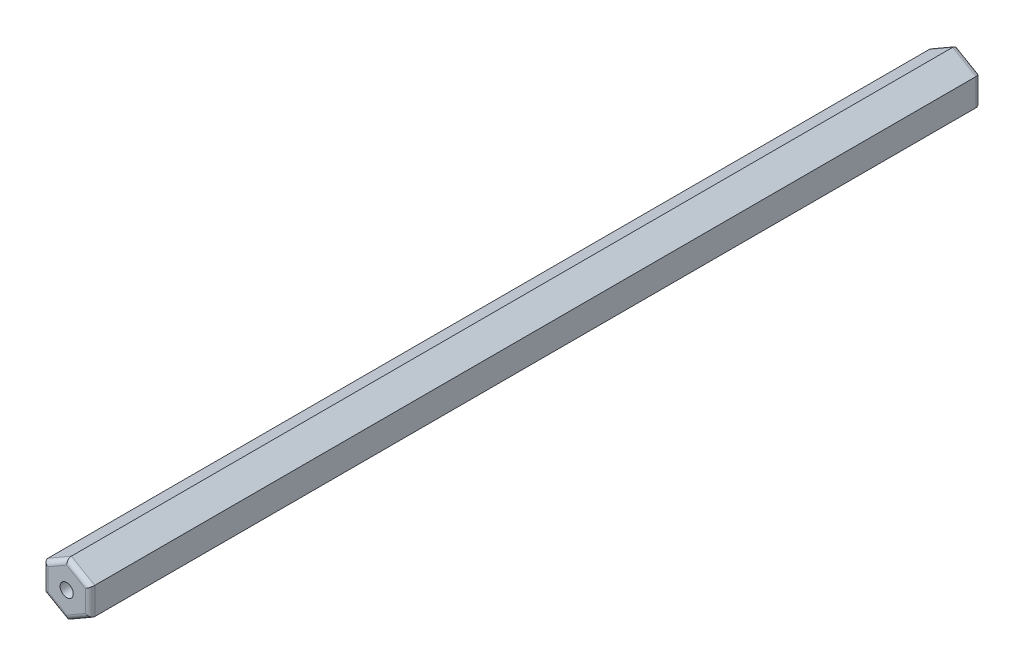
from build123d import *

# Parameters (mm, degrees)
RESSALTO_EXTRUS_O1_DEPTH = 95
FILETE1_R                = 0.5
ESBO_O2_R                = 0.701481341
CORTE_EXTRUS_O1_DEPTH    = 112.084775939


with BuildPart() as part:
    # Esboço1 → Ressalto-extrusão1 (new body)
    with BuildSketch(Plane.XY.offset(135)):
        Polygon((-55.002122675, 2.886751346), (-57.502122675, 1.443375673), (-57.502122675, -1.443375673), (-55.002122675, -2.886751346), (-52.502122675, -1.443375673), (-52.502122675, 1.443375673), align=None)
    extrude(amount=-RESSALTO_EXTRUS_O1_DEPTH)

    # Filete1
    filete1_edges = [part.edges().sort_by_distance(p)[0] for p in [
        (-53.752122675, -2.165063509, 135),
        (-56.252122675, -2.165063509, 135),
        (-52.502122675, 0, 135),
        (-57.502122675, 0, 135),
        (-53.752122675, 2.165063509, 135),
        (-56.252122675, 2.165063509, 135),
        (-53.752122675, -2.165063509, 40),
        (-56.252122675, -2.165063509, 40),
        (-52.502122675, 0, 40),
        (-57.502122675, 0, 40),
        (-53.752122675, 2.165063509, 40),
        (-56.252122675, 2.165063509, 40),
    ]]
    fillet(filete1_edges, radius=FILETE1_R)

    # Esboço2 → Corte-extrusão1 (cut, through all)
    with BuildSketch(Plane.XY.offset(135)):
        with Locations((-55.002122675, 0)):
            Circle(ESBO_O2_R)
    extrude(amount=-CORTE_EXTRUS_O1_DEPTH, mode=Mode.SUBTRACT)


solid = part.part
